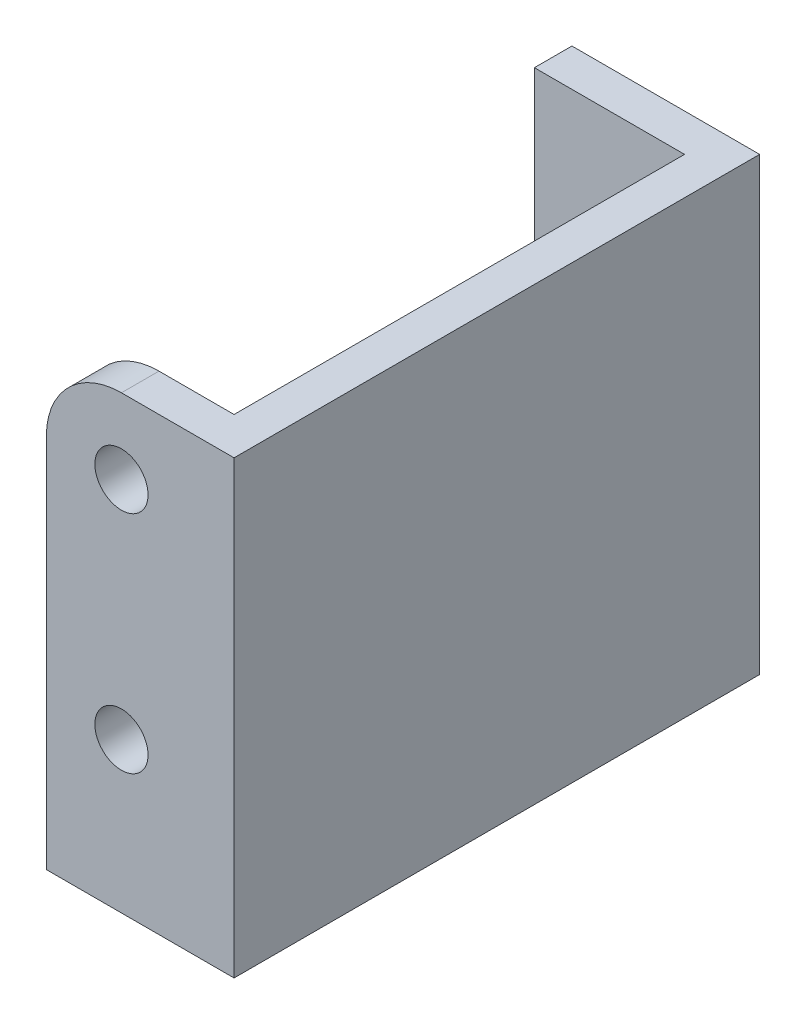
from build123d import *

# Parameters (mm, degrees)
SKETCH1_W           = 15.875
SKETCH1_H           = 38.1
BOSS_EXTRUDE1_DEPTH = 44.45
SHELL1_T            = -3.175
CUT_EXTRUDE1_REACH  = 51.007
SKETCH2_R           = 2.2479
FILLET2_R           = 6.35


with BuildPart() as part:
    # Sketch1 → Boss-Extrude1 (new body)
    with BuildSketch(Plane.XY):
        Rectangle(SKETCH1_W, SKETCH1_H)
    extrude(amount=-BOSS_EXTRUDE1_DEPTH)

    # Shell1
    shell1_openings = [part.faces().sort_by_distance(p)[0] for p in [
        (0, 19.05, -22.225),
        (-7.9375, 0, -22.225),
    ]]
    offset(amount=SHELL1_T, openings=shell1_openings, kind=Kind.INTERSECTION)

    # Sketch2 → Cut-Extrude1 (cut, up to next)
    with BuildSketch(Plane.XY, mode=Mode.PRIVATE) as cut_extrude1_sk1:
        with Locations((-1.5875, -6.35)):
            Circle(SKETCH2_R)
    cut_extrude1_tool1 = extrude(cut_extrude1_sk1.sketch, amount=-CUT_EXTRUDE1_REACH, mode=Mode.PRIVATE) & part.part
    # Sketch2 → Cut-Extrude1 (cut, up to next)
    with BuildSketch(Plane.XY, mode=Mode.PRIVATE) as cut_extrude1_sk2:
        with Locations((-1.5875, 12.7)):
            Circle(SKETCH2_R)
    cut_extrude1_tool2 = extrude(cut_extrude1_sk2.sketch, amount=-CUT_EXTRUDE1_REACH, mode=Mode.PRIVATE) & part.part
    add(cut_extrude1_tool1.solids().sort_by_distance((-1.5875, -6.35, 0))[0], mode=Mode.SUBTRACT)
    add(cut_extrude1_tool2.solids().sort_by_distance((-1.5875, 12.7, 0))[0], mode=Mode.SUBTRACT)

    # Fillet2
    fillet2_edges = [part.edges().sort_by_distance(p)[0] for p in [
        (-7.9375, 19.05, -1.5875),
    ]]
    fillet(fillet2_edges, radius=FILLET2_R)


solid = part.part
